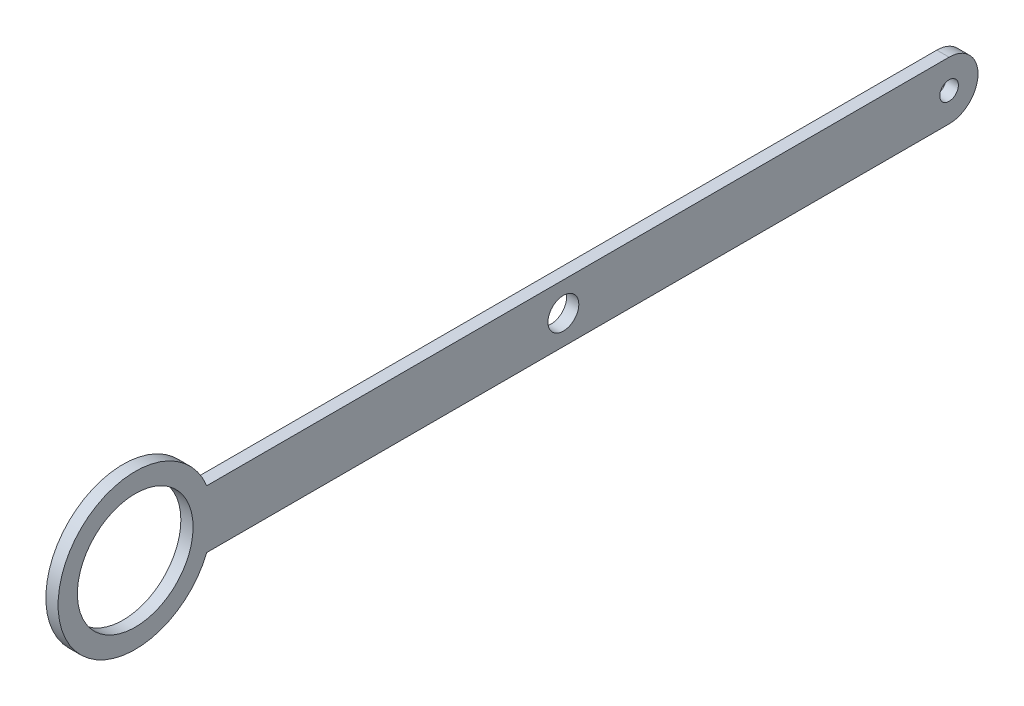
from build123d import *

# Parameters (mm, degrees)
SKETCH1_R           = 4
SKETCH1_R_2         = 2.415
SKETCH1_R_3         = 15
BOSS_EXTRUDE1_DEPTH = 3.175


with BuildPart() as part:
    # Sketch1 → Boss-Extrude1 (new body)
    with BuildSketch(Plane(origin=(0, 0, 0), x_dir=(0, 0, -1), z_dir=(1, 0, 0))):
        with BuildLine():
            ThreePointArc((100, -7.5), (107.5, 0), (100, 7.5))
            Line((100, 7.5), (-92.459503782, 7.5))
            ThreePointArc((-92.459503782, 7.5), (-131, 0), (-92.459503782, -7.5))
            Line((-92.459503782, -7.5), (100, -7.5))
        make_face()
        Circle(SKETCH1_R, mode=Mode.SUBTRACT)
        with Locations((100, 0)):
            Circle(SKETCH1_R_2, mode=Mode.SUBTRACT)
        with Locations((-111, 0)):
            Circle(SKETCH1_R_3, mode=Mode.SUBTRACT)
    extrude(amount=BOSS_EXTRUDE1_DEPTH)


solid = part.part
